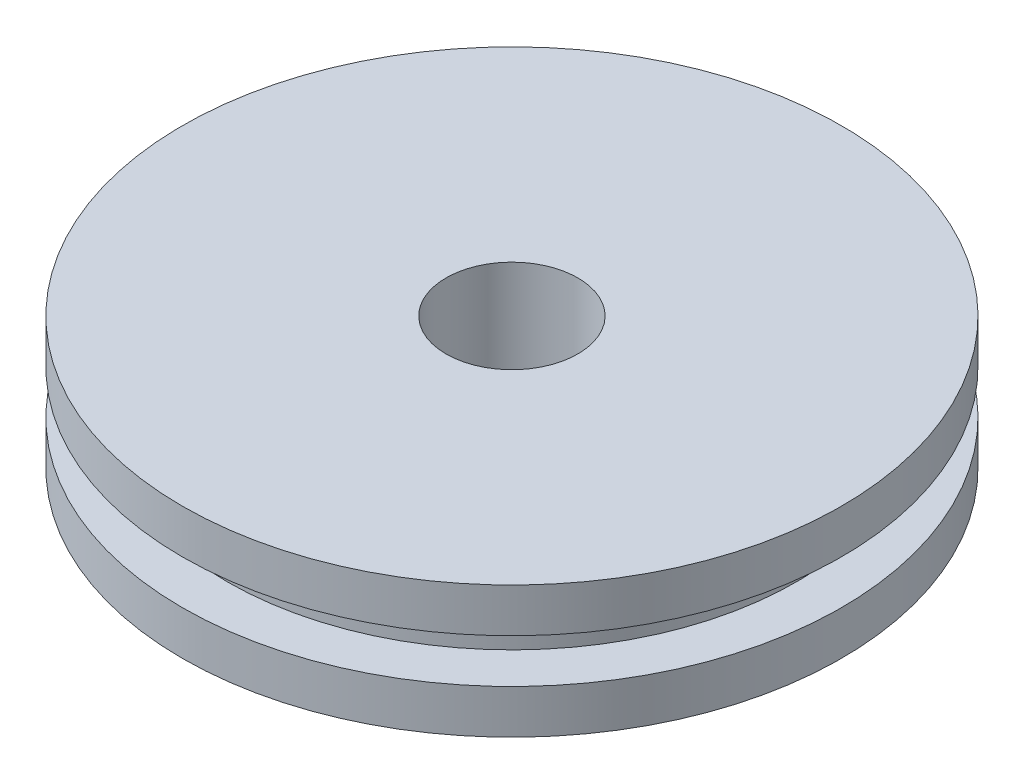
from build123d import *

# Parameters (mm, degrees)
SKETCH1_R           = 15.875
BOSS_EXTRUDE1_DEPTH = 2.116666667
SKETCH2_R           = 13.716
BOSS_EXTRUDE2_DEPTH = 2.116666667
SKETCH3_R           = 15.875
BOSS_EXTRUDE3_DEPTH = 2.116666667
SKETCH6_R           = 3.175
CUT_EXTRUDE2_DEPTH  = 24.3313898


with BuildPart() as part:
    # Sketch1 → Boss-Extrude1 (new body)
    with BuildSketch(Plane(origin=(0, 0, 0), x_dir=(1, 0, 0), z_dir=(0, 1, 0))):
        Circle(SKETCH1_R)
    extrude(amount=BOSS_EXTRUDE1_DEPTH)

    # Sketch2 → Boss-Extrude2 (add)
    with BuildSketch(Plane(origin=(0, 2.116666667, 0), x_dir=(1, 0, 0), z_dir=(0, 1, 0))):
        Circle(SKETCH2_R)
    extrude(amount=BOSS_EXTRUDE2_DEPTH)

    # Sketch3 → Boss-Extrude3 (add)
    with BuildSketch(Plane(origin=(0, 4.233333333, 0), x_dir=(1, 0, 0), z_dir=(0, 1, 0))):
        Circle(SKETCH3_R)
    extrude(amount=BOSS_EXTRUDE3_DEPTH)

    # Sketch6 → Cut-Extrude2 (cut, through all)
    with BuildSketch(Plane(origin=(0, 6.35, 0), x_dir=(1, 0, 0), z_dir=(0, 1, 0))):
        Circle(SKETCH6_R)
    extrude(amount=-CUT_EXTRUDE2_DEPTH, mode=Mode.SUBTRACT)


solid = part.part
